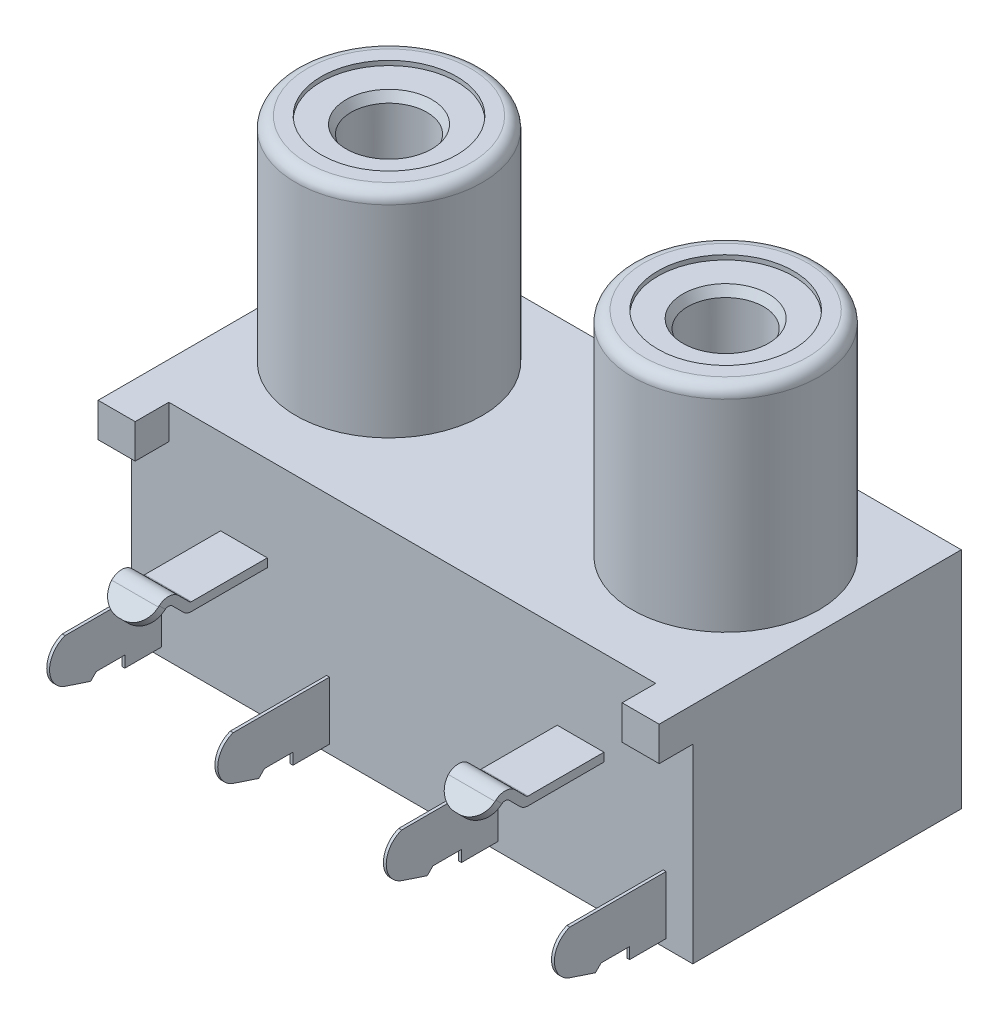
from build123d import *
from OCP.BRepFilletAPI import BRepFilletAPI_MakeChamfer

# Parameters (mm, degrees)
BOSS_EXTRUDE1_START  = -8.54202
BOSS_EXTRUDE1_DEPTH  = 17.08404
SKETCH2_W            = 17.08404
SKETCH2_H            = 15.394205122
BOSS_EXTRUDE2_DEPTH  = 1.861548776
CUT_EXTRUDE1_DEPTH   = 21.904260683
SKETCH4_W            = 17.08404
SKETCH4_H            = 3.81
CUT_EXTRUDE2_DEPTH   = 3.430805122
SKETCH5_W            = 17.08404
SKETCH5_H            = 2.83718
CUT_EXTRUDE3_DEPTH   = 3.58862049
SKETCH6_W            = 17.08404
SKETCH6_H            = 0.508
CUT_EXTRUDE4_DEPTH   = 1.27
CUT_EXTRUDE5_DEPTH   = 12.91844
BOSS_EXTRUDE3_DEPTH  = 2.7686
BOSS_EXTRUDE4_START  = 2.7686
BOSS_EXTRUDE4_DEPTH  = 2.7686
CUT_EXTRUDE6_DEPTH   = 7.366
CUT_EXTRUDE7_START   = -7.366
CUT_EXTRUDE7_DEPTH   = 7.366
CUT_EXTRUDE8_DEPTH   = 7.38124
SKETCH13_W           = 11.9634
SKETCH13_H           = 9.61898
BOSS_EXTRUDE5_DEPTH  = 1.18999
SKETCH14_W           = 11.9634
SKETCH14_H           = 9.61898
BOSS_EXTRUDE6_DEPTH  = 1.18999
SKETCH15_W           = 25.00122
SKETCH15_H           = 11.9634
BOSS_EXTRUDE7_DEPTH  = 0.381
SKETCH16_W           = 2.0828
SKETCH16_H           = 0.381
BOSS_EXTRUDE8_DEPTH  = 1.170076836
SKETCH17_W           = 2.0828
SKETCH17_H           = 0.381
BOSS_EXTRUDE9_DEPTH  = 1.170076836
SKETCH18_W           = 1.651
SKETCH18_H           = 1.524
BOSS_EXTRUDE10_DEPTH = 1.4986
SKETCH19_W           = 1.651
SKETCH19_H           = 1.524
BOSS_EXTRUDE11_DEPTH = 1.4986
DRAFT1_ANGLE         = 45
DRAFT2_ANGLE         = 45
DRAFT3_START         = 2
DRAFT3_OUTLINE_W     = 0.127
DRAFT3_OUTLINE_H     = 0.359210245
DRAFT3_DEPTH         = 1.370290122
DRAFT4_ANGLE         = 45
DRAFT5_ANGLE         = 45
DRAFT6_START         = 2
DRAFT6_OUTLINE_W     = 0.127
DRAFT6_OUTLINE_H     = 0.359210245
DRAFT6_DEPTH         = 1.370290122
SKETCH20_W           = 4.1529
SKETCH20_H           = 9.4996
SKETCH21_W           = 4.1529
SKETCH21_H           = 9.4996
CHAMFER1_SIZE        = 0.219970453
CHAMFER1_SIZE2       = 0.381
FILLET1_R            = 0.127
FILLET2_R            = 0.254
FILLET3_R            = 0.508
FILLET4_R            = 0.635
FILLET5_R            = 0.9652


with BuildPart() as part:
    # Boss-Extrude1: read off the stored shape, not the designer's step
    # Boss-Extrude1 outline → Boss-Extrude1 (new body)
    with BuildSketch(Plane.YZ.offset(BOSS_EXTRUDE1_START)):
        with BuildLine():
            Line((-4.61899, 8.8773), (-4.61899, -5.9817))
            Line((-4.61899, -5.9817), (3.138441224, -5.9817))
            Line((3.138441224, -5.9817), (3.138441224, 9.412505122))
            Line((3.138441224, 9.412505122), (1.894807928, 10.656138418))
            Line((1.894807928, 10.656138418), (0.80899, 9.57032049))
            Line((0.80899, 9.57032049), (-2.025596867, 9.57032049))
            ThreePointArc((-2.025596867, 9.57032049), (-2.65500458, 10.898809938), (-3.985803445, 10.2743))
            Line((-3.985803445, 10.2743), (-4.449253679, 8.8773))
            Line((-4.449253679, 8.8773), (-4.61899, 8.8773))
        make_face()
    extrude(amount=BOSS_EXTRUDE1_DEPTH)

    # Sketch2 → Boss-Extrude2 (add)
    with BuildSketch(Plane(origin=(0, 3.138441224, 0), x_dir=(-1, 0, 0), z_dir=(0, 1, 0))):
        with Locations((0, 1.715402561)):
            Rectangle(SKETCH2_W, SKETCH2_H)
    extrude(amount=BOSS_EXTRUDE2_DEPTH)

    # Sketch3 → Cut-Extrude1 (cut, through all)
    with BuildSketch(Plane.ZY.offset(8.54202)):
        with BuildLine():
            Line((9.57032049, -2.025596867), (9.57032049, -2.02819))
            Line((9.57032049, -2.02819), (10.2743, -2.02819))
            ThreePointArc((10.2743, -2.02819), (9.922536007, -1.965603788), (9.57032049, -2.025596867))
        make_face()
    extrude(amount=-CUT_EXTRUDE1_DEPTH, mode=Mode.SUBTRACT)

    # Sketch4 → Cut-Extrude2 (cut)
    with BuildSketch(Plane.XY.offset(9.412505122)):
        with Locations((0, 3.09499)):
            Rectangle(SKETCH4_W, SKETCH4_H)
    extrude(amount=-CUT_EXTRUDE2_DEPTH, mode=Mode.SUBTRACT)

    # Sketch5 → Cut-Extrude3 (cut)
    with BuildSketch(Plane.XY.offset(9.57032049)):
        with Locations((0, -0.6096)):
            Rectangle(SKETCH5_W, SKETCH5_H)
    extrude(amount=-CUT_EXTRUDE3_DEPTH, mode=Mode.SUBTRACT)

    # Sketch6 → Cut-Extrude4 (cut)
    with BuildSketch(Plane.XY.offset(8.8773)):
        with Locations((0, -4.36499)):
            Rectangle(SKETCH6_W, SKETCH6_H)
    extrude(amount=-CUT_EXTRUDE4_DEPTH, mode=Mode.SUBTRACT)

    # Sketch7 → Cut-Extrude5 (cut)
    with BuildSketch(Plane(origin=(-6.45922, 0, 0), x_dir=(0, -1, 0), z_dir=(-1, 0, 0))):
        Polygon((-0.80899, 9.57032049), (-1.894807928, 10.656138418), (-3.138441224, 9.412505122), (-1.18999, 9.412505122), (-1.18999, 5.9817), (-0.80899, 5.9817), align=None)
    extrude(amount=-CUT_EXTRUDE5_DEPTH, mode=Mode.SUBTRACT)

    # Sketch8 → Boss-Extrude3 (add)
    with BuildSketch(Plane(origin=(8.54202, 0, 0), x_dir=(0, 0, -1), z_dir=(1, 0, 0))):
        with BuildLine():
            Line((-7.6073, -4.11099), (-8.8773, -4.11099))
            Line((-8.8773, -4.11099), (-8.8773, -4.449253679))
            Line((-8.8773, -4.449253679), (-10.2743, -3.985803445))
            ThreePointArc((-10.2743, -3.985803445), (-10.9601, -3.006996722), (-10.2743, -2.02819))
            Line((-10.2743, -2.02819), (-5.9817, -2.02819))
            Line((-5.9817, -2.02819), (-5.9817, 4.99999))
            Line((-5.9817, 4.99999), (5.9817, 4.99999))
            Line((5.9817, 4.99999), (5.9817, -4.61899))
            Line((5.9817, -4.61899), (-7.6073, -4.61899))
            Line((-7.6073, -4.61899), (-7.6073, -4.11099))
        make_face()
    extrude(amount=BOSS_EXTRUDE3_DEPTH)

    # Sketch9 → Boss-Extrude4 (add)
    with BuildSketch(Plane.ZY.offset(8.54202).offset(BOSS_EXTRUDE4_START)):
        with BuildLine():
            Line((10.2743, -3.985803445), (8.8773, -4.449253679))
            Line((8.8773, -4.449253679), (8.8773, -4.11099))
            Line((8.8773, -4.11099), (7.6073, -4.11099))
            Line((7.6073, -4.11099), (7.6073, -4.61899))
            Line((7.6073, -4.61899), (-5.9817, -4.61899))
            Line((-5.9817, -4.61899), (-5.9817, 4.99999))
            Line((-5.9817, 4.99999), (5.9817, 4.99999))
            Line((5.9817, 4.99999), (5.9817, -2.02819))
            Line((5.9817, -2.02819), (10.2743, -2.02819))
            ThreePointArc((10.2743, -2.02819), (10.9601, -3.006996723), (10.2743, -3.985803445))
        make_face()
    extrude(amount=-BOSS_EXTRUDE4_DEPTH)

    # Sketch10 → Cut-Extrude6 (cut)
    with BuildSketch(Plane(origin=(-11.18362, 0, 0), x_dir=(0, -1, 0), z_dir=(-1, 0, 0))):
        with BuildLine():
            Line((4.449253679, 8.8773), (3.985803445, 10.2743))
            ThreePointArc((3.985803445, 10.2743), (3.006996722, 10.9601), (2.02819, 10.2743))
            Line((2.02819, 10.2743), (2.02819, 5.9817))
            Line((2.02819, 5.9817), (4.61899, 5.9817))
            Line((4.61899, 5.9817), (4.61899, 7.6073))
            Line((4.61899, 7.6073), (4.11099, 7.6073))
            Line((4.11099, 7.6073), (4.11099, 8.8773))
            Line((4.11099, 8.8773), (4.449253679, 8.8773))
        make_face()
    extrude(amount=-CUT_EXTRUDE6_DEPTH, mode=Mode.SUBTRACT)

    # Sketch11 → Cut-Extrude7 (cut)
    with BuildSketch(Plane(origin=(11.18362, 0, 0), x_dir=(0, 0, -1), z_dir=(1, 0, 0)).offset(CUT_EXTRUDE7_START)):
        with BuildLine():
            Line((-8.8773, -4.11099), (-7.6073, -4.11099))
            Line((-7.6073, -4.11099), (-7.6073, -4.61899))
            Line((-7.6073, -4.61899), (-5.9817, -4.61899))
            Line((-5.9817, -4.61899), (-5.9817, -2.02819))
            Line((-5.9817, -2.02819), (-10.2743, -2.02819))
            ThreePointArc((-10.2743, -2.02819), (-10.9601, -3.006996723), (-10.2743, -3.985803445))
            Line((-10.2743, -3.985803445), (-8.8773, -4.449253679))
            Line((-8.8773, -4.449253679), (-8.8773, -4.11099))
        make_face()
    extrude(amount=CUT_EXTRUDE7_DEPTH, mode=Mode.SUBTRACT)

    # Sketch12 → Cut-Extrude8 (cut)
    with BuildSketch(Plane(origin=(-3.69062, 0, 0), x_dir=(0, -1, 0), z_dir=(-1, 0, 0))):
        with BuildLine():
            Line((4.449253679, 8.8773), (3.985803445, 10.2743))
            ThreePointArc((3.985803445, 10.2743), (3.006996723, 10.9601), (2.02819, 10.2743))
            Line((2.02819, 10.2743), (2.02819, 5.9817))
            Line((2.02819, 5.9817), (4.61899, 5.9817))
            Line((4.61899, 5.9817), (4.61899, 7.6073))
            Line((4.61899, 7.6073), (4.11099, 7.6073))
            Line((4.11099, 7.6073), (4.11099, 8.8773))
            Line((4.11099, 8.8773), (4.449253679, 8.8773))
        make_face()
    extrude(amount=-CUT_EXTRUDE8_DEPTH, mode=Mode.SUBTRACT)

    # Sketch13 → Boss-Extrude5 (add)
    with BuildSketch(Plane(origin=(11.31062, 0, 0), x_dir=(0, 0, -1), z_dir=(1, 0, 0))):
        with Locations((0, 0.1905)):
            Rectangle(SKETCH13_W, SKETCH13_H)
    extrude(amount=BOSS_EXTRUDE5_DEPTH)

    # Sketch14 → Boss-Extrude6 (add)
    with BuildSketch(Plane.ZY.offset(11.31062)):
        with Locations((0, 0.1905)):
            Rectangle(SKETCH14_W, SKETCH14_H)
    extrude(amount=BOSS_EXTRUDE6_DEPTH)

    # Sketch15 → Boss-Extrude7 (add)
    with BuildSketch(Plane.XZ.offset(4.61899)):
        Rectangle(SKETCH15_W, SKETCH15_H)
    extrude(amount=BOSS_EXTRUDE7_DEPTH)

    # Sketch16 → Boss-Extrude8 (add)
    with BuildSketch(Plane(origin=(0, -4.380665245, 4.380665245), x_dir=(1, 0, 0), z_dir=(0, -0.7071067811870595, 0.7071067811860355))):
        with Locations((-7.50062, 8.684359272)):
            Rectangle(SKETCH16_W, SKETCH16_H)
    extrude(amount=BOSS_EXTRUDE8_DEPTH)

    # Sketch17 → Boss-Extrude9 (add)
    with BuildSketch(Plane(origin=(0, -4.380665245, 4.380665245), x_dir=(1, 0, 0), z_dir=(0, -0.7071067811870595, 0.7071067811860355))):
        with Locations((7.50062, 8.684359272)):
            Rectangle(SKETCH17_W, SKETCH17_H)
    extrude(amount=BOSS_EXTRUDE9_DEPTH)

    # Sketch18 → Boss-Extrude10 (add)
    with BuildSketch(Plane.XY.offset(5.9817)):
        with Locations((11.67511, 4.23799)):
            Rectangle(SKETCH18_W, SKETCH18_H)
    extrude(amount=BOSS_EXTRUDE10_DEPTH)

    # Sketch19 → Boss-Extrude11 (add)
    with BuildSketch(Plane.XY.offset(5.9817)):
        with Locations((-11.67511, 4.23799)):
            Rectangle(SKETCH19_W, SKETCH19_H)
    extrude(amount=BOSS_EXTRUDE11_DEPTH)

    # Draft1
    draft1_faces = [part.faces().sort_by_distance(p)[0] for p in [
        (7.50062, 2.164215612, 9.412505122),
    ]]
    draft(draft1_faces, Plane(origin=(-8.54202, 1.18999, 5.9817), x_dir=(0, 0, 1), z_dir=(0, 1, 0)), DRAFT1_ANGLE)

    # Draft2
    draft2_faces = [part.faces().sort_by_distance(p)[0] for p in [
        (-7.50062, 2.164215612, 9.412505122),
    ]]
    draft(draft2_faces, Plane(origin=(-8.54202, 1.18999, 5.9817), x_dir=(0, 0, 1), z_dir=(0, 1, 0)), DRAFT2_ANGLE)

    # Draft3: read off the stored shape, not the designer's step
    # Draft3 outline → Draft3 (cut)
    with BuildSketch(Plane(origin=(0, 0, 0), x_dir=(1, 0, 0), z_dir=(0, 0.707106781186548, 0.707106781186547)).offset(DRAFT3_START)):
        with Locations((3.75412, -9.363713058)):
            Rectangle(DRAFT3_OUTLINE_W, DRAFT3_OUTLINE_H)
    extrude(amount=DRAFT3_DEPTH, mode=Mode.SUBTRACT)

    # Draft4
    draft4_faces = [part.faces().sort_by_distance(p)[0] for p in [
        (-3.75412, -4.280121839, 8.8773),
    ]]
    draft(draft4_faces, Plane(origin=(8.54202, -4.11099, 7.6073), x_dir=(-1, 0, 0), z_dir=(0, -1, 0)), DRAFT4_ANGLE)

    # Draft5
    draft5_faces = [part.faces().sort_by_distance(p)[0] for p in [
        (-11.24712, -4.280121839, 8.8773),
    ]]
    draft(draft5_faces, Plane(origin=(8.54202, -4.11099, 7.6073), x_dir=(-1, 0, 0), z_dir=(0, -1, 0)), DRAFT5_ANGLE)

    # Draft6: read off the stored shape, not the designer's step
    # Draft6 outline → Draft6 (cut)
    with BuildSketch(Plane(origin=(0, 0, 0), x_dir=(1, 0, 0), z_dir=(0, 0.707106781186548, 0.707106781186547)).offset(DRAFT6_START)):
        with Locations((11.24712, -9.363713058)):
            Rectangle(DRAFT6_OUTLINE_W, DRAFT6_OUTLINE_H)
    extrude(amount=DRAFT6_DEPTH, mode=Mode.SUBTRACT)

    # Sketch20 → Revolve1 (revolve)
    with BuildSketch(Plane(origin=(0, 0, -0.4826), x_dir=(-1, 0, 0), z_dir=(0, 0, -1)), mode=Mode.PRIVATE) as revolve1_sk:
        with Locations((5.42417, 9.74979)):
            Rectangle(SKETCH20_W, SKETCH20_H)
    revolve(revolve1_sk.sketch.rotate(Axis((-7.50062, 4.99999, -0.4826), (0, 1, 0)), 180), axis=Axis((-7.50062, 4.99999, -0.4826), (0, 1, 0)))

    # Sketch21 → Revolve2 (revolve)
    with BuildSketch(Plane(origin=(0, 0, -0.4826), x_dir=(-1, 0, 0), z_dir=(0, 0, -1)), mode=Mode.PRIVATE) as revolve2_sk:
        with Locations((-9.57707, 9.74979)):
            Rectangle(SKETCH21_W, SKETCH21_H)
    revolve(revolve2_sk.sketch.rotate(Axis((7.50062, 4.99999, -0.4826), (0, 1, 0)), 180), axis=Axis((7.50062, 4.99999, -0.4826), (0, 1, 0)))

    # Sketch22 → Cut-Revolve1 (revolve, cut)
    with BuildSketch(Plane(origin=(0, 0, -0.4826), x_dir=(-1, 0, 0), z_dir=(0, 0, -1)), mode=Mode.PRIVATE) as cut_revolve1_sk:
        Polygon((5.81152, 4.99999), (7.50062, 4.99999), (7.50062, 14.49959), (4.47802, 14.49959), (4.47802, 14.29639), (3.85572, 14.29639), (3.85572, 14.16939), (5.81152, 14.16939), align=None)
    revolve(cut_revolve1_sk.sketch.rotate(Axis((-7.50062, 4.99999, -0.4826), (0, 1, 0)), 270), axis=Axis((-7.50062, 4.99999, -0.4826), (0, 1, 0)), mode=Mode.SUBTRACT)

    # Sketch23 → Cut-Revolve2 (revolve, cut)
    with BuildSketch(Plane(origin=(0, 0, -0.4826), x_dir=(-1, 0, 0), z_dir=(0, 0, -1)), mode=Mode.PRIVATE) as cut_revolve2_sk:
        Polygon((-9.18972, 4.99999), (-7.50062, 4.99999), (-7.50062, 14.49959), (-10.52322, 14.49959), (-10.52322, 14.29639), (-11.14552, 14.29639), (-11.14552, 14.16939), (-9.18972, 14.16939), align=None)
    revolve(cut_revolve2_sk.sketch.rotate(Axis((7.50062, 4.99999, -0.4826), (0, 1, 0)), 270), axis=Axis((7.50062, 4.99999, -0.4826), (0, 1, 0)), mode=Mode.SUBTRACT)

    # Chamfer1: one chamfer whose edges measure the first distance from different faces: ONE call of the kernel's chamfer builder (chamfer() names one face for all edges)
    chamfer1_edges_1 = [part.edges().sort_by_distance(p)[0] for p in [
        (-7.50062, 14.16939, -2.1717),
    ]]
    chamfer1_side_1 = [part.faces().sort_by_distance(p)[0] for p in [
        (-7.50062, 14.16939, -4.02440666),
    ]]
    chamfer1_edges_2 = [part.edges().sort_by_distance(p)[0] for p in [
        (7.50062, 14.16939, -2.1717),
    ]]
    chamfer1_side_2 = [part.faces().sort_by_distance(p)[0] for p in [
        (7.50062, 14.16939, -4.02440666),
    ]]
    chamfer1 = BRepFilletAPI_MakeChamfer(part.part.solid().wrapped)
    for e in chamfer1_edges_1:
        chamfer1.Add(CHAMFER1_SIZE, CHAMFER1_SIZE2, e.wrapped, chamfer1_side_1[0].wrapped)  # the first distance lies on this face
    for e in chamfer1_edges_2:
        chamfer1.Add(CHAMFER1_SIZE, CHAMFER1_SIZE2, e.wrapped, chamfer1_side_2[0].wrapped)  # the first distance lies on this face
    add(Compound.cast(chamfer1.Shape()), mode=Mode.REPLACE)

    # Fillet1
    fillet1_edges = [part.edges().sort_by_distance(p)[0] for p in [
        (-7.50062, 1.18999, 9.412505122),
        (7.50062, 1.18999, 9.412505122),
    ]]
    fillet(fillet1_edges, radius=FILLET1_R)

    # Fillet2
    fillet2_edges = [part.edges().sort_by_distance(p)[0] for p in [
        (-7.50062, 1.625400245, 10.386730735),
        (7.50062, 1.625400245, 10.386730735),
    ]]
    fillet(fillet2_edges, radius=FILLET2_R)

    # Fillet3
    fillet3_edges = [part.edges().sort_by_distance(p)[0] for p in [
        (-7.50062, 0.80899, 9.57032049),
        (-3.34772, 14.49959, -0.4826),
        (11.65352, 14.49959, -0.4826),
        (7.50062, 0.80899, 9.57032049),
    ]]
    fillet(fillet3_edges, radius=FILLET3_R)

    # Fillet4
    fillet4_edges = [part.edges().sort_by_distance(p)[0] for p in [
        (-7.50062, 2.164215612, 10.386730734),
        (7.50062, 2.164215612, 10.386730734),
    ]]
    fillet(fillet4_edges, radius=FILLET4_R)

    # Fillet5
    fillet5_edges = [part.edges().sort_by_distance(p)[0] for p in [
        (6.45922, 0.932734821, 11.348803842),
        (8.54202, 0.932734821, 11.348803842),
        (-6.45922, 0.932734821, 11.348803842),
        (-8.54202, 0.932734821, 11.348803842),
    ]]
    fillet(fillet5_edges, radius=FILLET5_R)


solid = part.part
